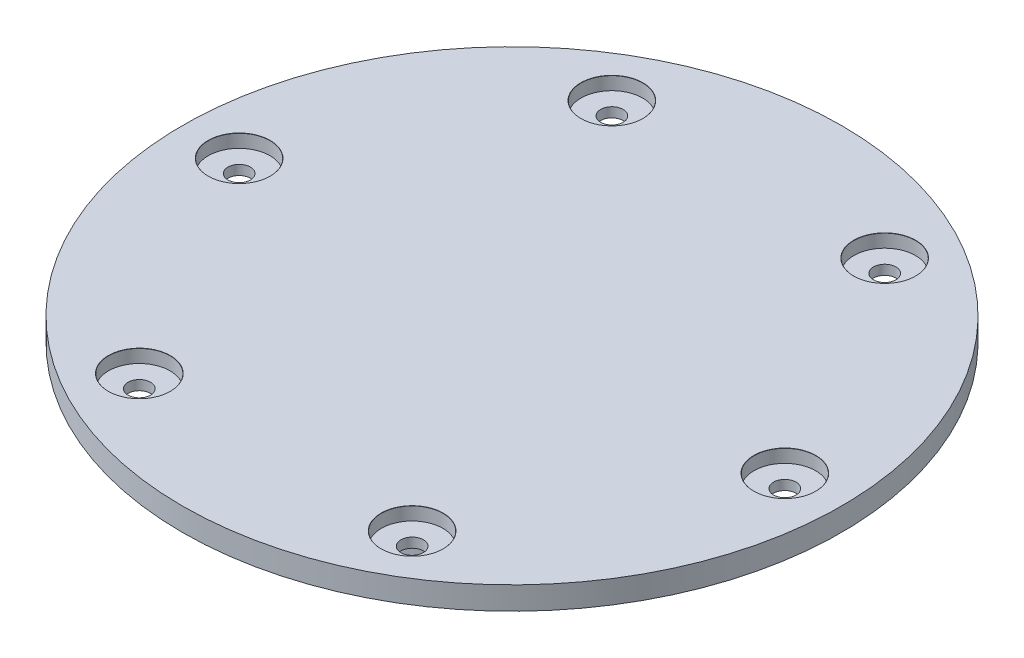
from build123d import *

# Parameters (mm, degrees)
ESQUISSE1_R                                = 32.53
BOSS_EXTRU_1_DEPTH                         = 8.03
ESQUISSE2_R                                = 49.956
BOSS_EXTRU_2_DEPTH                         = 3.47
CHAMBRAGE_POUR_VIS_T_TE_HEXAGONALE_2_COUNT = 2
CHAMBRAGE_POUR_VIS_T_TE_HEXAGONALE_2_PITCH = 41.356
CHAMBRAGE_POUR_VIS_T_TE_HEXAGONALE_3_COUNT = 2
CHAMBRAGE_POUR_VIS_T_TE_HEXAGONALE_3_PITCH = 71.630693198
CHAMBRAGE_POUR_VIS_T_TE_HEXAGONALE_4_COUNT = 2
CHAMBRAGE_POUR_VIS_T_TE_HEXAGONALE_4_PITCH = 82.712
CHAMBRAGE_POUR_VIS_T_TE_HEXAGONALE_5_COUNT = 2
CHAMBRAGE_POUR_VIS_T_TE_HEXAGONALE_5_PITCH = 71.630693198
CHAMBRAGE_POUR_VIS_T_TE_HEXAGONALE_6_COUNT = 2
CHAMBRAGE_POUR_VIS_T_TE_HEXAGONALE_6_PITCH = 41.356


with BuildPart() as part:
    # Esquisse1 → Boss.-Extru.1 (new body)
    with BuildSketch(Plane(origin=(0, 0, 0), x_dir=(1, 0, 0), z_dir=(0, 1, 0))):
        Circle(ESQUISSE1_R)
    extrude(amount=-BOSS_EXTRU_1_DEPTH)

    # Esquisse2 → Boss.-Extru.2 (add)
    with BuildSketch(Plane(origin=(0, 0, 0), x_dir=(1, 0, 0), z_dir=(0, 1, 0))):
        Circle(ESQUISSE2_R)
    extrude(amount=BOSS_EXTRU_2_DEPTH)

    # Esquisse6 → Chambrage pour vis à tête hexagonale M33 (revolve, cut)
    with BuildSketch(Plane(origin=(-41.356, 3.47, 0), x_dir=(0, 0, 1), z_dir=(1, 0, 0))):
        Polygon((0, 0), (0, 11.5), (1.7, 11.5), (1.7, 2), (4.6755, 2), (4.6755, 0.025), (4.7005, 0), align=None)
    chambrage_pour_vis_t_te_hexagonale_m33 = revolve(axis=Axis((-41.356, 9.82, 0), (0, -1, 0)), mode=Mode.SUBTRACT)

    # Chambrage pour vis _ t_te hexagonale 2: Chambrage pour vis à tête hexagonale M33 ×2
    with Locations(*[Vector(0.4999999999999995, 0, -0.8660254037844389) * (i * CHAMBRAGE_POUR_VIS_T_TE_HEXAGONALE_2_PITCH) for i in range(1, CHAMBRAGE_POUR_VIS_T_TE_HEXAGONALE_2_COUNT)]):
        add(chambrage_pour_vis_t_te_hexagonale_m33, mode=Mode.SUBTRACT)

    # Chambrage pour vis _ t_te hexagonale 3: Chambrage pour vis à tête hexagonale M33 ×2
    with Locations(*[Vector(0.8660254037844378, 0, -0.5000000000000017) * (i * CHAMBRAGE_POUR_VIS_T_TE_HEXAGONALE_3_PITCH) for i in range(1, CHAMBRAGE_POUR_VIS_T_TE_HEXAGONALE_3_COUNT)]):
        add(chambrage_pour_vis_t_te_hexagonale_m33, mode=Mode.SUBTRACT)

    # Chambrage pour vis _ t_te hexagonale 4: Chambrage pour vis à tête hexagonale M33 ×2
    with Locations(*[(i * CHAMBRAGE_POUR_VIS_T_TE_HEXAGONALE_4_PITCH, 0, 0) for i in range(1, CHAMBRAGE_POUR_VIS_T_TE_HEXAGONALE_4_COUNT)]):
        add(chambrage_pour_vis_t_te_hexagonale_m33, mode=Mode.SUBTRACT)

    # Chambrage pour vis _ t_te hexagonale 5: Chambrage pour vis à tête hexagonale M33 ×2
    with Locations(*[Vector(0.8660254037844396, 0, 0.4999999999999985) * (i * CHAMBRAGE_POUR_VIS_T_TE_HEXAGONALE_5_PITCH) for i in range(1, CHAMBRAGE_POUR_VIS_T_TE_HEXAGONALE_5_COUNT)]):
        add(chambrage_pour_vis_t_te_hexagonale_m33, mode=Mode.SUBTRACT)

    # Chambrage pour vis _ t_te hexagonale 6: Chambrage pour vis à tête hexagonale M33 ×2
    with Locations(*[Vector(0.5000000000000002, 0, 0.8660254037844386) * (i * CHAMBRAGE_POUR_VIS_T_TE_HEXAGONALE_6_PITCH) for i in range(1, CHAMBRAGE_POUR_VIS_T_TE_HEXAGONALE_6_COUNT)]):
        add(chambrage_pour_vis_t_te_hexagonale_m33, mode=Mode.SUBTRACT)


solid = part.part
